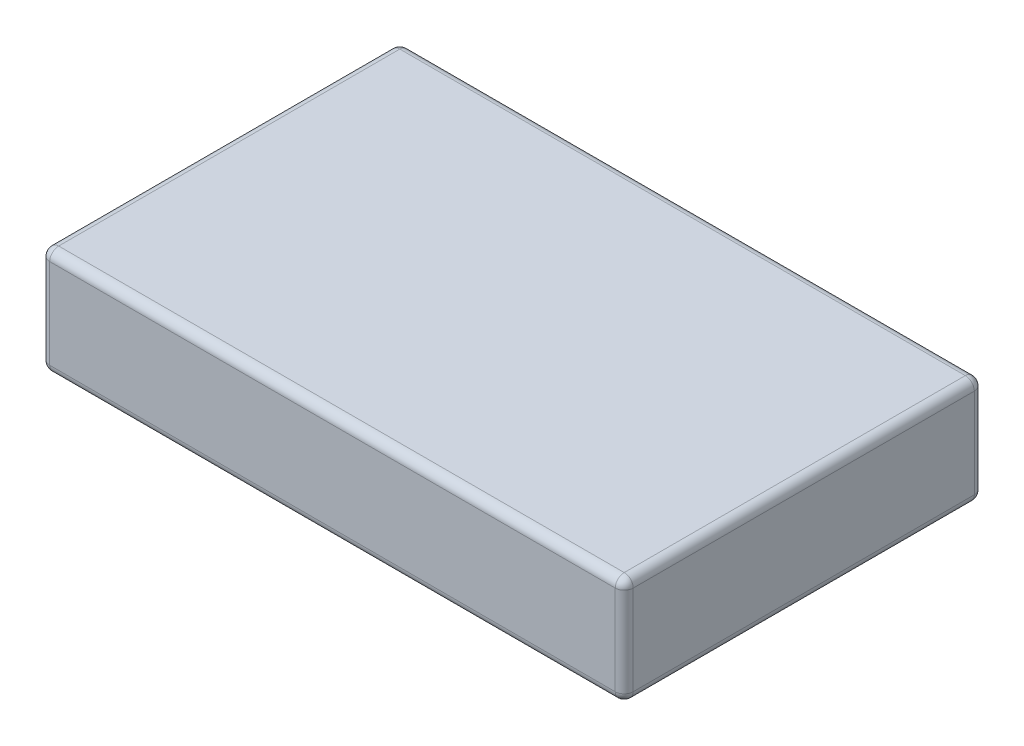
from build123d import *

# Parameters (mm, degrees)
SKETCH2_W           = 65
SKETCH2_H           = 40
BOSS_EXTRUDE1_DEPTH = 12
FILLET1_R           = 1


with BuildPart() as part:
    # Sketch2 → Boss-Extrude1 (new body)
    with BuildSketch(Plane(origin=(0, 0, 0), x_dir=(1, 0, 0), z_dir=(0, 1, 0))):
        with Locations((32.5, 20)):
            Rectangle(SKETCH2_W, SKETCH2_H)
    extrude(amount=BOSS_EXTRUDE1_DEPTH)

    # Fillet1
    fillet1_edges = [part.edges().sort_by_distance(p)[0] for p in [
        (0, 0, -20),
        (0, 6, -40),
        (32.5, 0, -40),
        (65, 6, -40),
        (65, 0, -20),
        (32.5, 12, -40),
        (65, 12, -20),
        (0, 12, -20),
        (0, 6, 0),
        (32.5, 12, 0),
        (65, 6, 0),
        (32.5, 0, 0),
    ]]
    fillet(fillet1_edges, radius=FILLET1_R)


solid = part.part
